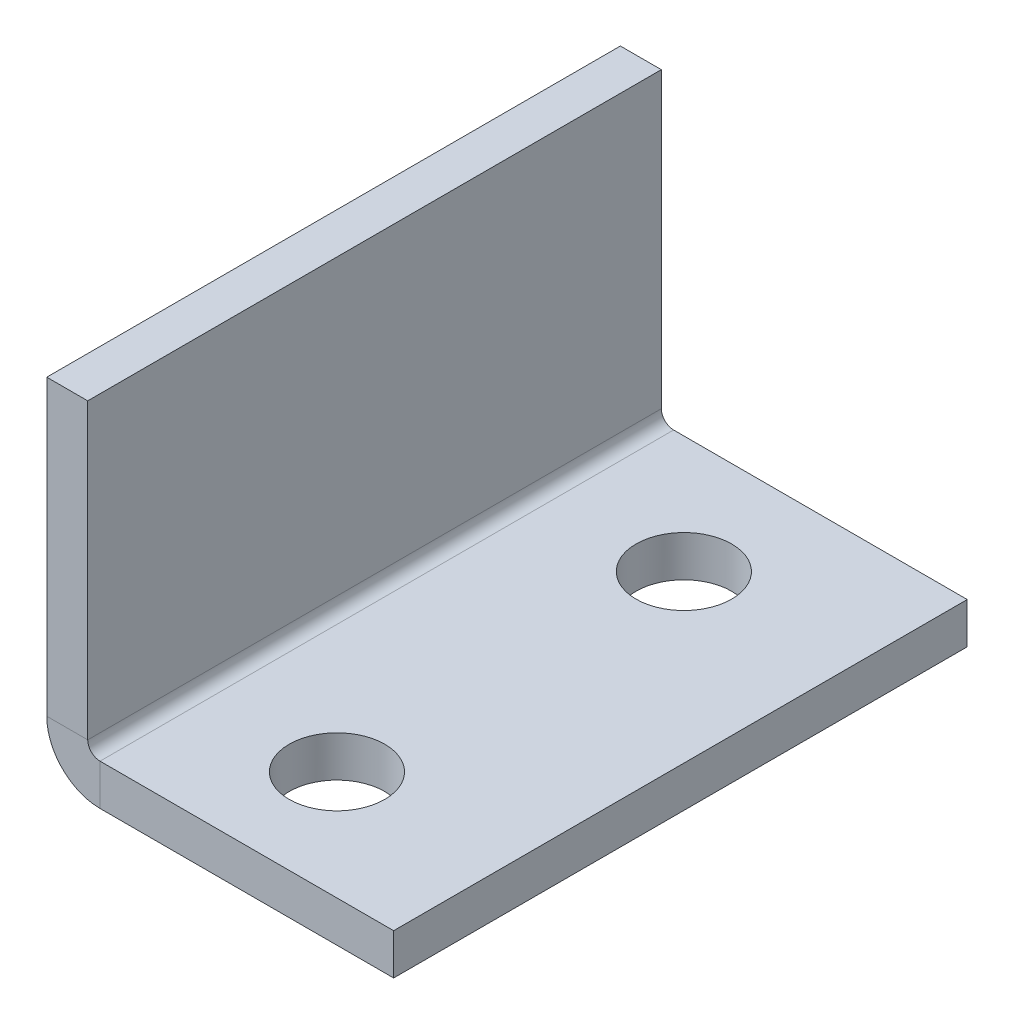
from build123d import *

# Parameters (mm, degrees)
FLANGE_BASE1_DEPTH    = 42
ESBO_O2_R             = 3.5
CORTE_EXTRUS_O1_DEPTH = 56.265902689


# Sheet-metal steps are written as plain solids
with BuildPart() as part:
    # Esboço1 → Flange-base1 (new body)
    with BuildSketch(Plane.XY):
        with BuildLine():
            Line((0, 25.4), (0, 3.9))
            ThreePointArc((0, 3.9), (1.142283553, 1.142283553), (3.9, 0))
            Line((3.9, 0), (25.4, 0))
            Line((25.4, 0), (25.4, 3))
            Line((25.4, 3), (3.9, 3))
            ThreePointArc((3.9, 3), (3.263603897, 3.263603897), (3, 3.9))
            Line((3, 3.9), (3, 25.4))
            Line((3, 25.4), (0, 25.4))
        make_face()
    extrude(amount=FLANGE_BASE1_DEPTH)

    # Esboço2 → Corte-extrusão1 (cut, through all)
    with BuildSketch(Plane(origin=(0, 0, 0), x_dir=(-1, 0, 0), z_dir=(0, -1, 0))):
        with Locations(Location((-13.25, -34, 0), (0, 0, 90))):
            Circle(ESBO_O2_R)
        with Locations(Location((-13.25, -8.6, 0), (0, 0, 90))):
            Circle(ESBO_O2_R)
    extrude(amount=-CORTE_EXTRUS_O1_DEPTH, mode=Mode.SUBTRACT)


solid = part.part
